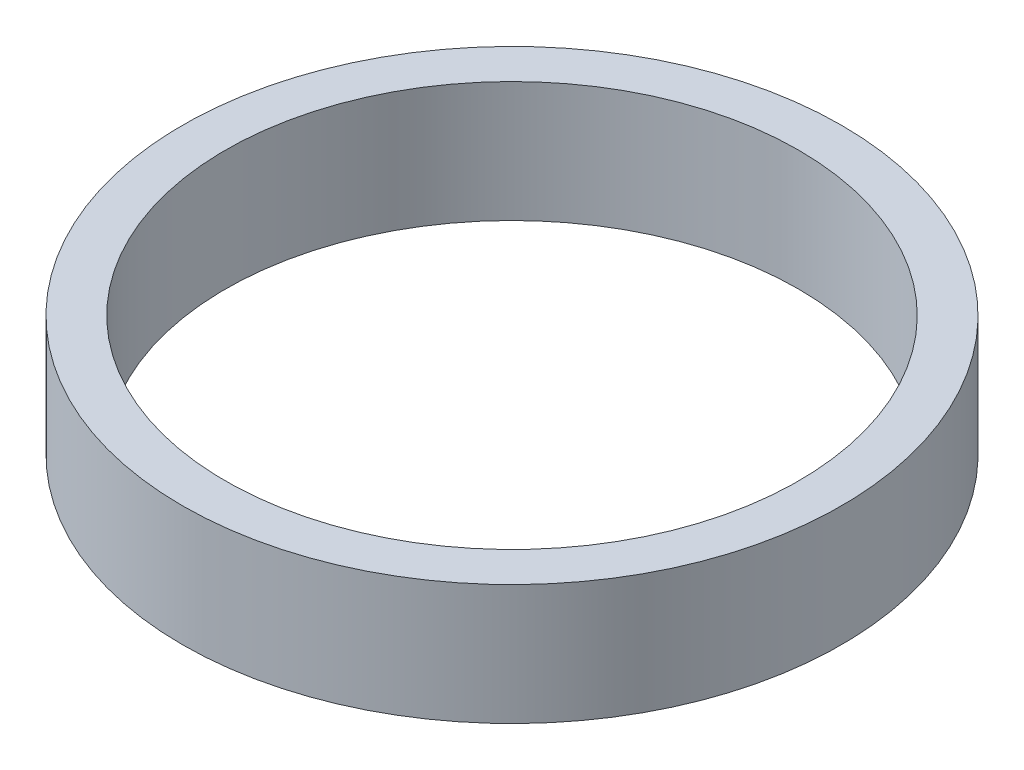
from build123d import *

# Parameters (mm, degrees)
SKETCH1_R           = 57.5
BOSS_EXTRUDE1_DEPTH = 21
SKETCH2_R           = 50
CUT_EXTRUDE1_DEPTH  = 84.985117729


with BuildPart() as part:
    # Sketch1 → Boss-Extrude1 (new body)
    with BuildSketch(Plane(origin=(0, 0, 0), x_dir=(1, 0, 0), z_dir=(0, 1, 0))):
        Circle(SKETCH1_R)
    extrude(amount=BOSS_EXTRUDE1_DEPTH)

    # Sketch2 → Cut-Extrude1 (cut, through all)
    with BuildSketch(Plane(origin=(0, 0, 0), x_dir=(1, 0, 0), z_dir=(0, 1, 0))):
        Circle(SKETCH2_R)
    extrude(amount=CUT_EXTRUDE1_DEPTH, mode=Mode.SUBTRACT)


solid = part.part
